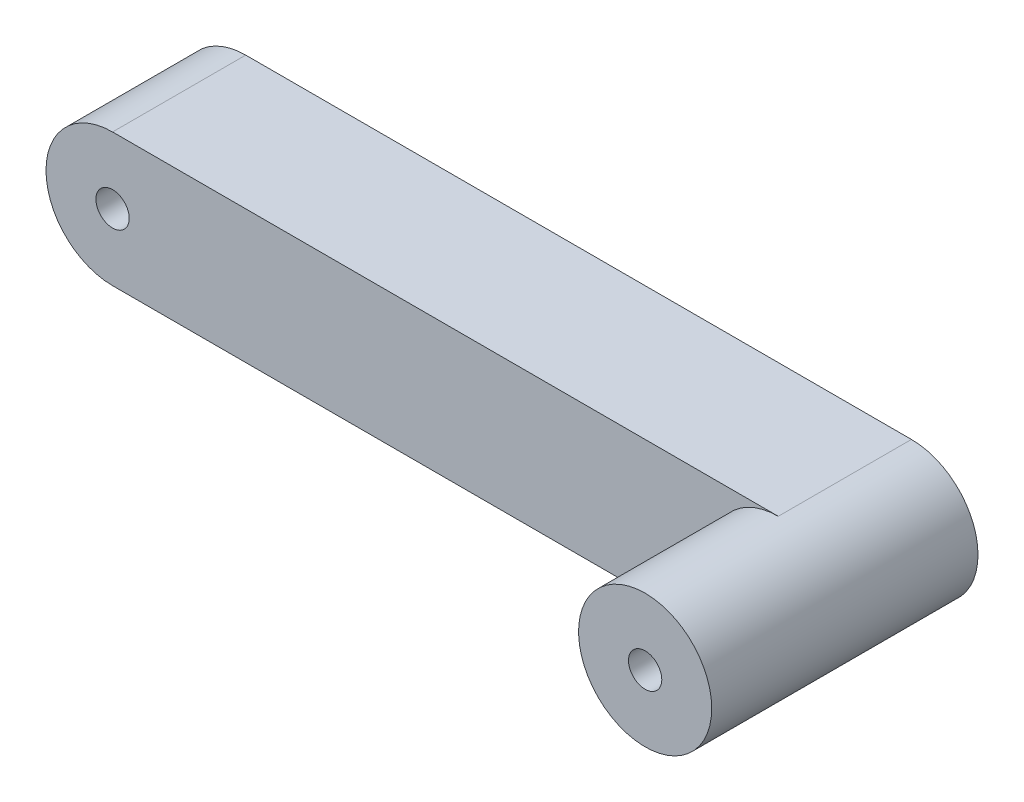
from build123d import *
from build123d.topology import SkipClean

# Parameters (mm, degrees)
SKETCH_1_R      = 0.5
EXTRUDE_1_DEPTH = 4
SKETCH_2_R      = 2
SKETCH_2_R_2    = 0.5
EXTRUDE_2_DEPTH = 4


with BuildPart() as part:
    # 草图1 → 凸台-拉伸1 (new body)
    with BuildSketch(Plane.XY):
        with BuildLine():
            Line((0, 2), (20, 2))
            ThreePointArc((20, 2), (22, 0), (20, -2))
            Line((20, -2), (0, -2))
            ThreePointArc((0, -2), (-2, 0), (0, 2))
        make_face()
        Circle(SKETCH_1_R, mode=Mode.SUBTRACT)
        with Locations((20, 0)):
            Circle(SKETCH_1_R, mode=Mode.SUBTRACT)
    extrude(amount=EXTRUDE_1_DEPTH)

    # 草图2 → 凸台-拉伸2 (add)
    with SkipClean():  # the faces are left unmerged after this step: merging them gives an invalid solid
        with BuildSketch(Plane.XY.offset(4)):
            with Locations((20, 0)):
                Circle(SKETCH_2_R)
            with Locations((20, 0)):
                Circle(SKETCH_2_R_2, mode=Mode.SUBTRACT)
        extrude(amount=EXTRUDE_2_DEPTH)
    add(part.part.scale(1), mode=Mode.REPLACE)  # the faces are merged on a copy


solid = part.part
